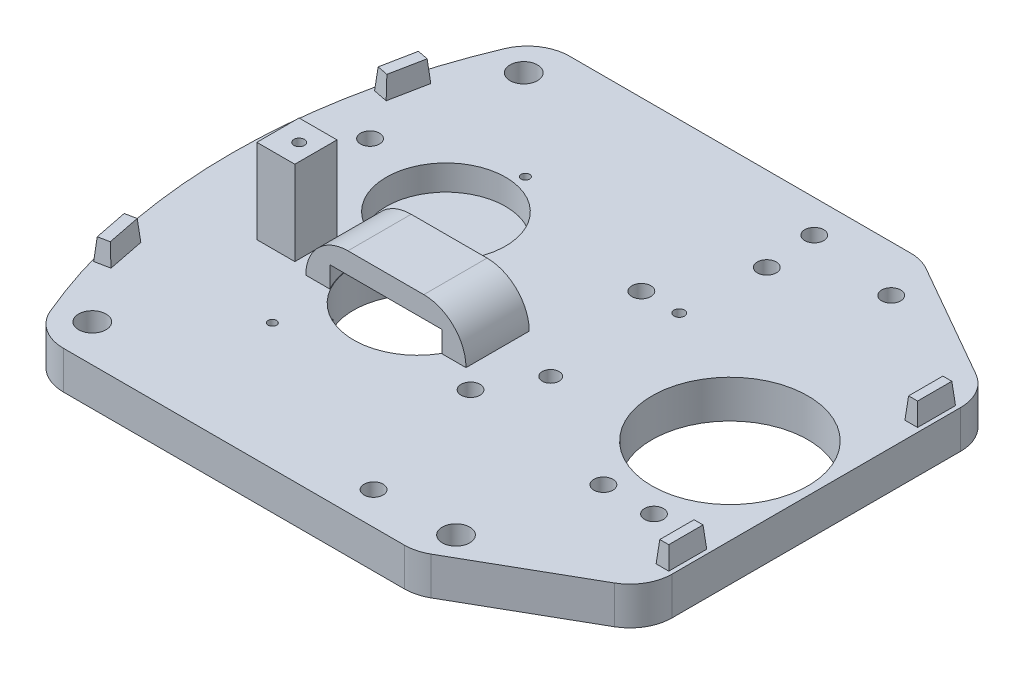
from build123d import *

# Parameters (mm, degrees)
SKETCH1_W                         = 125
SKETCH1_H                         = 120
TOP_BASE_DEPTH                    = 9
SKETCH5_R                         = 14.15
DRIVE_GEAR_HOLE_DEPTH             = 6
SKETCH28_R                        = 15.15
TWO_STAGE_GEAR_HOLE_DEPTH         = 174.51080658
SKETCH8_R                         = 18.5
XL320_FINGER_KNUCKLE_MOUNT_DEPTH  = 174.51080658
SKETCH26_R                        = 1
STRING_HOLES_DEPTH                = 174.51080658
XL320_MOUNT_HOLES_R               = 2.25
XL320_MOUNT_HOLES_M4_DEPTH        = 174.51080658
AX12_MOUNT_HOLES_R                = 2.25
AX12_MOUNT_HOLES_M4_DEPTH         = 174.51080658
NUTS_M4_DEPTH                     = 5
SKETCH34_R                        = 15
HOLES_FOR_M4_IN_FINGER_GEAR_DEPTH = 2
SKETCH31_W                        = 38
SKETCH31_H                        = 15
BOSS_EXTRUDE1_DEPTH               = 10
SKETCH32_R                        = 15.25
CUT_EXTRUDE5_DEPTH                = 5
SKETCH33_R                        = 1
CUT_EXTRUDE6_DEPTH                = 2.5
FILLET2_R                         = 10
CUT_EXTRUDE8_DEPTH                = 174.565549577
FILLET4_R                         = 10
SKETCH37_R                        = 3.25
CONNECT_HOLES_M6_DEPTH            = 10
SKETCH41_R                        = 2
CONNECT_TO_HOUSE_M4_DEPTH         = 174.565549577
SKETCH42_W                        = 3
SKETCH42_H                        = 9
HOUSING_FITS_DEPTH                = 5
HOUSING_FITS_DRAFT                = 5
HOUSING_FITS_PROFILE_2_DEPTH      = 5
HOUSING_FITS_PROFILE_2_DRAFT      = 5
HOUSING_FITS_PROFILE_3_DEPTH      = 5
HOUSING_FITS_PROFILE_3_DRAFT      = 5
HOUSING_FITS_PROFILE_4_DEPTH      = 5
HOUSING_FITS_PROFILE_4_DRAFT      = 5
SKETCH43_R                        = 1
M2_SHAFT_HOLE_DEPTH               = 2
SKETCH54_R                        = 1.5
HOLLOW_SHAFT_HOLE_DEPTH           = 5
SKETCH46_R                        = 1.25
CUT_EXTRUDE11_DEPTH               = 174.565549577
SKETCH47_R                        = 2.25
CUT_EXTRUDE12_DEPTH               = 5
SKETCH48_R                        = 2.875
CUT_EXTRUDE13_DEPTH               = 0.75
SKETCH49_R                        = 1.25
BOSS_EXTRUDE2_DEPTH               = 20
SKETCH51_R                        = 1.25
CUT_EXTRUDE14_DEPTH               = 175.427635425
SKETCH52_R                        = 2.25
CUT_EXTRUDE15_DEPTH               = 5
SKETCH53_R                        = 2.875
CUT_EXTRUDE16_DEPTH               = 0.75


with BuildPart() as part:
    # Sketch1 → Top_Base (new body)
    with BuildSketch(Plane(origin=(0, 0, 0), x_dir=(1, 0, 0), z_dir=(0, 1, 0))):
        with BuildLine():
            ThreePointArc((0, 120), (-13.654246239, 60), (0, 0))
            Line((0, 0), (0, 120))
        make_face()
        with Locations((62.5, 60)):
            Rectangle(SKETCH1_W, SKETCH1_H)
    extrude(amount=TOP_BASE_DEPTH)

    # Sketch5 → Drive_Gear_Hole (cut)
    with BuildSketch(Plane(origin=(0, 9, 0), x_dir=(1, 0, 0), z_dir=(0, 1, 0))):
        with Locations(Location((23.75, 73.41386581, 0), (0, 0, 270))):
            Circle(SKETCH5_R)
    extrude(amount=-DRIVE_GEAR_HOLE_DEPTH, mode=Mode.SUBTRACT)

    # Sketch28 → Two_Stage_Gear_Hole (cut, through all)
    with BuildSketch(Plane(origin=(0, 9, 0), x_dir=(1, 0, 0), z_dir=(0, 1, 0))):
        with Locations(Location((39.169567191, 51.25, 0), (0, 0, 270))):
            Circle(SKETCH28_R)
    extrude(amount=-TWO_STAGE_GEAR_HOLE_DEPTH, mode=Mode.SUBTRACT)

    # Sketch8 → XL320_Finger_Knuckle_Mount (cut, through all)
    with BuildSketch(Plane(origin=(0, 9, 0), x_dir=(1, 0, 0), z_dir=(0, 1, 0))):
        with Locations(Location((104.5, 60, 0), (0, 0, 270))):
            Circle(SKETCH8_R)
    extrude(amount=-XL320_FINGER_KNUCKLE_MOUNT_DEPTH, mode=Mode.SUBTRACT)

    # Sketch26 → String_Holes (cut, through all)
    with BuildSketch(Plane.XZ.offset(-9)):
        with Locations(Location((26, -30, 0), (0, 0, 270))):
            Circle(SKETCH26_R)
        with Locations(Location((26, -90, 0), (0, 0, 90))):
            Circle(SKETCH26_R)
    extrude(amount=STRING_HOLES_DEPTH, mode=Mode.SUBTRACT)

    # XL320_Mount_Holes → XL320_Mount_Holes_(M4) (cut, through all)
    with BuildSketch(Plane(origin=(0, 9, 0), x_dir=(1, 0, 0), z_dir=(0, 1, 0))):
        with Locations(Location((110.5, 36, 0), (0, 0, 270))):
            Circle(XL320_MOUNT_HOLES_R)
        with Locations(Location((98.5, 36, 0), (0, 0, 270))):
            Circle(XL320_MOUNT_HOLES_R)
        with Locations(Location((-0.25, 79.41386581, 0), (0, 0, 270))):
            Circle(XL320_MOUNT_HOLES_R)
        with Locations(Location((-0.25, 67.41386581, 0), (0, 0, 270))):
            Circle(XL320_MOUNT_HOLES_R)
    extrude(amount=-XL320_MOUNT_HOLES_M4_DEPTH, mode=Mode.SUBTRACT)

    # AX12_Mount_Holes → AX12_Mount_Holes_(M4) (cut, through all)
    with BuildSketch(Plane(origin=(0, 9, 0), x_dir=(1, 0, 0), z_dir=(0, 1, 0))):
        with Locations(Location((72.25, 112.25, 0), (0, 0, 270))):
            Circle(AX12_MOUNT_HOLES_R)
        with Locations(Location((63.25, 80.25, 0), (0, 0, 270))):
            Circle(AX12_MOUNT_HOLES_R)
        with Locations(Location((73.25, 100, 0), (0, 0, 270))):
            Circle(AX12_MOUNT_HOLES_R)
        with Locations(Location((93.75, 109, 0), (0, 0, 270))):
            Circle(AX12_MOUNT_HOLES_R)
        with Locations(Location((63.25, 39.75, 0), (0, 0, 270))):
            Circle(AX12_MOUNT_HOLES_R)
        with Locations(Location((72.25, 7.75, 0), (0, 0, 270))):
            Circle(AX12_MOUNT_HOLES_R)
    extrude(amount=-AX12_MOUNT_HOLES_M4_DEPTH, mode=Mode.SUBTRACT)

    # Sketch27 → Nuts_(M4) (cut)
    with BuildSketch(Plane.XZ):
        Polygon((110.5, -31.958548116), (107, -33.979274058), (107, -38.020725942), (110.5, -40.041451884), (114, -38.020725942), (114, -33.979274058), align=None)
        Polygon((98.5, -31.958548116), (95, -33.979274058), (95, -38.020725942), (98.5, -40.041451884), (102, -38.020725942), (102, -33.979274058), align=None)
        Polygon((3.25, -65.393139868), (-0.25, -63.372413926), (-3.75, -65.393139868), (-3.75, -69.434591752), (-0.25, -71.455317694), (3.25, -69.434591752), align=None)
        Polygon((-3.75, -77.393139868), (-3.75, -81.434591752), (-0.25, -83.455317694), (3.25, -81.434591752), (3.25, -77.393139868), (-0.25, -75.372413926), align=None)
    extrude(amount=-NUTS_M4_DEPTH, mode=Mode.SUBTRACT)

    # Sketch34 → Holes_For_M4_In_Finger_Gear (cut)
    with BuildSketch(Plane.XZ):
        with Locations((26, -30)):
            Circle(SKETCH34_R)
        with Locations(Location((26, -90, 0), (0, 0, 270))):
            Circle(SKETCH34_R)
    extrude(amount=-HOLES_FOR_M4_IN_FINGER_GEAR_DEPTH, mode=Mode.SUBTRACT)

    # Sketch31 → Boss-Extrude1 (add)
    with BuildSketch(Plane(origin=(0, 9, 0), x_dir=(1, 0, 0), z_dir=(0, 1, 0))):
        with Locations((39.169567191, 51.25)):
            Rectangle(SKETCH31_W, SKETCH31_H)
    extrude(amount=BOSS_EXTRUDE1_DEPTH)

    # Sketch32 → Cut-Extrude5 (cut)
    with BuildSketch(Plane.XZ.offset(-9)):
        with Locations((39.169567191, -51.25)):
            Circle(SKETCH32_R)
    extrude(amount=-CUT_EXTRUDE5_DEPTH, mode=Mode.SUBTRACT)

    # Sketch33 → Cut-Extrude6 (cut)
    with BuildSketch(Plane.XZ.offset(-14)):
        with Locations(Location((39.169567191, -51.25, 0), (0, 0, 270))):
            Circle(SKETCH33_R)
    extrude(amount=-CUT_EXTRUDE6_DEPTH, mode=Mode.SUBTRACT)

    # Fillet2
    fillet2_edges = [part.edges().sort_by_distance(p)[0] for p in [
        (58.169567191, 19, -51.25),
        (20.169567191, 19, -51.25),
    ]]
    fillet(fillet2_edges, radius=FILLET2_R - 0.0001)  # a hair under: the kernel refuses the full size

    # Sketch36 → Cut-Extrude8 (cut, through all)
    with BuildSketch(Plane(origin=(0, 9, 0), x_dir=(1, 0, 0), z_dir=(0, 1, 0))):
        Polygon((90, 120), (125, 100), (125, 120), align=None)
        Polygon((125, 0), (90, 0), (125, 20), align=None)
    extrude(amount=-CUT_EXTRUDE8_DEPTH, mode=Mode.SUBTRACT)

    # Fillet4
    fillet4_edges = [part.edges().sort_by_distance(p)[0] for p in [
        (90, 4.5, -120),
        (125, 4.5, -100),
        (125, 4.5, -20),
        (90, 4.5, 0),
        (0, 4.5, -120),
        (0, 4.5, 0),
    ]]
    fillet(fillet4_edges, radius=FILLET4_R)

    # Sketch37 → Connect_Holes_(M6) (cut)
    with BuildSketch(Plane(origin=(0, 9, 0), x_dir=(1, 0, 0), z_dir=(0, 1, 0))):
        with Locations(Location((4.459226107, 111.152938298, 0), (0, 0, 270))):
            Circle(SKETCH37_R)
        with Locations(Location((4.459226107, 8.847061702, 0), (0, 0, 270))):
            Circle(SKETCH37_R)
        with Locations(Location((91.344355629, 8.205555711, 0), (0, 0, 270))):
            Circle(SKETCH37_R)
    extrude(amount=-CONNECT_HOLES_M6_DEPTH, mode=Mode.SUBTRACT)

    # Sketch41 → Connect_To_House_(M4) (cut, through all)
    with BuildSketch(Plane(origin=(0, 9, 0), x_dir=(1, 0, 0), z_dir=(0, 1, 0))):
        with Locations(Location((70, 52, 0), (0, 0, 270))):
            Circle(SKETCH41_R)
    extrude(amount=-CONNECT_TO_HOUSE_M4_DEPTH, mode=Mode.SUBTRACT)


with BuildPart() as housing_fits_tool:
    # Sketch42 → Housing_Fits (with draft: the straight prism first)
    with BuildSketch(Plane(origin=(0, 9, 0), x_dir=(1, 0, 0), z_dir=(0, 1, 0))):
        with Locations((122.5, 30.5)):
            Rectangle(SKETCH42_W, SKETCH42_H)
    extrude(amount=HOUSING_FITS_DEPTH)
    # Housing_Fits: the draft: its side faces are tilted about the plane it starts from
    housing_fits_sides = [housing_fits_tool.faces().sort_by_distance(p)[0] for p in [
        (124, 11.5, -30.5),
        (122.5, 11.5, -35),
        (121, 11.5, -30.5),
        (122.5, 11.5, -26),
    ]]
    draft(housing_fits_sides, Plane(origin=(0, 9, 0), x_dir=(1, 0, 0), z_dir=(0, 1, 0)), HOUSING_FITS_DRAFT)


with BuildPart() as part_1:
    add(part.part)

    # Housing_Fits: add housing_fits_tool
    add(housing_fits_tool.part)


with BuildPart() as housing_fits_profile_2_tool:
    # Sketch42 → Housing_Fits profile 2 (with draft: the straight prism first)
    with BuildSketch(Plane(origin=(0, 9, 0), x_dir=(1, 0, 0), z_dir=(0, 1, 0))):
        Polygon((-9.533377338, 30.232888291), (-7.782151246, 21.404909633), (-4.349048435, 22.085942002), (-6.100274527, 30.91392066), align=None)
    extrude(amount=HOUSING_FITS_PROFILE_2_DEPTH)
    # Housing_Fits profile 2: the draft: its side faces are tilted about the plane it starts from
    housing_fits_profile_2_sides = [housing_fits_profile_2_tool.faces().sort_by_distance(p)[0] for p in [
        (-8.657764292, 11.5, -25.818898962),
        (-6.065599841, 11.5, -21.745425818),
        (-5.224661481, 11.5, -26.499931331),
        (-7.816825933, 11.5, -30.573404475),
    ]]
    draft(housing_fits_profile_2_sides, Plane(origin=(0, 9, 0), x_dir=(1, 0, 0), z_dir=(0, 1, 0)), HOUSING_FITS_PROFILE_2_DRAFT)


with BuildPart() as part_2:
    add(part_1.part)

    # Housing_Fits profile 2: add housing_fits_profile_2_tool
    add(housing_fits_profile_2_tool.part)


with BuildPart() as housing_fits_profile_3_tool:
    # Sketch42 → Housing_Fits profile 3 (with draft: the straight prism first)
    with BuildSketch(Plane(origin=(0, 9, 0), x_dir=(1, 0, 0), z_dir=(0, 1, 0))):
        Polygon((-4.349048435, 97.914057998), (-7.782151246, 98.595090367), (-9.533377338, 89.767111709), (-6.100274527, 89.08607934), align=None)
    extrude(amount=HOUSING_FITS_PROFILE_3_DEPTH)
    # Housing_Fits profile 3: the draft: its side faces are tilted about the plane it starts from
    housing_fits_profile_3_sides = [housing_fits_profile_3_tool.faces().sort_by_distance(p)[0] for p in [
        (-6.065599841, 11.5, -98.254574182),
        (-8.657764292, 11.5, -94.181101038),
        (-7.816825933, 11.5, -89.426595525),
        (-5.224661481, 11.5, -93.500068669),
    ]]
    draft(housing_fits_profile_3_sides, Plane(origin=(0, 9, 0), x_dir=(1, 0, 0), z_dir=(0, 1, 0)), HOUSING_FITS_PROFILE_3_DRAFT)


with BuildPart() as part_3:
    add(part_2.part)

    # Housing_Fits profile 3: add housing_fits_profile_3_tool
    add(housing_fits_profile_3_tool.part)


with BuildPart() as housing_fits_profile_4_tool:
    # Sketch42 → Housing_Fits profile 4 (with draft: the straight prism first)
    with BuildSketch(Plane(origin=(0, 9, 0), x_dir=(1, 0, 0), z_dir=(0, 1, 0))):
        with Locations((122.5, 89.5)):
            Rectangle(SKETCH42_W, SKETCH42_H)
    extrude(amount=HOUSING_FITS_PROFILE_4_DEPTH)
    # Housing_Fits profile 4: the draft: its side faces are tilted about the plane it starts from
    housing_fits_profile_4_sides = [housing_fits_profile_4_tool.faces().sort_by_distance(p)[0] for p in [
        (122.5, 11.5, -94),
        (121, 11.5, -89.5),
        (122.5, 11.5, -85),
        (124, 11.5, -89.5),
    ]]
    draft(housing_fits_profile_4_sides, Plane(origin=(0, 9, 0), x_dir=(1, 0, 0), z_dir=(0, 1, 0)), HOUSING_FITS_PROFILE_4_DRAFT)


with BuildPart() as part_4:
    add(part_3.part)

    # Housing_Fits profile 4: add housing_fits_profile_4_tool
    add(housing_fits_profile_4_tool.part)

    # Sketch43 → M2_Shaft_Hole (cut)
    with BuildSketch(Plane.XZ):
        with Locations(Location((39.169567191, -68.75, 0), (0, 0, 270))):
            Circle(SKETCH43_R)
    extrude(amount=-M2_SHAFT_HOLE_DEPTH, mode=Mode.SUBTRACT)

    # Sketch54 → Hollow_Shaft_Hole (cut)
    with BuildSketch(Plane.XZ.offset(-2)):
        with Locations(Location((26, -30, 0), (0, 0, 270))):
            Circle(SKETCH54_R)
        with Locations(Location((26, -90, 0), (0, 0, 270))):
            Circle(SKETCH54_R)
    extrude(amount=-HOLLOW_SHAFT_HOLE_DEPTH, mode=Mode.SUBTRACT)

    # Sketch46 → Cut-Extrude11 (cut, through all)
    with BuildSketch(Plane(origin=(0, 9, 0), x_dir=(1, 0, 0), z_dir=(0, 1, 0))):
        with Locations(Location((72.25, 80.25, 0), (0, 0, 270))):
            Circle(SKETCH46_R)
    extrude(amount=-CUT_EXTRUDE11_DEPTH, mode=Mode.SUBTRACT)

    # Sketch47 → Cut-Extrude12 (cut)
    with BuildSketch(Plane.XZ):
        with Locations(Location((72.25, -80.25, 0), (0, 0, 270))):
            Circle(SKETCH47_R)
    extrude(amount=-CUT_EXTRUDE12_DEPTH, mode=Mode.SUBTRACT)

    # Sketch48 → Cut-Extrude13 (cut)
    with BuildSketch(Plane.XZ):
        with Locations(Location((72.25, -80.25, 0), (0, 0, 270))):
            Circle(SKETCH48_R)
    extrude(amount=-CUT_EXTRUDE13_DEPTH, mode=Mode.SUBTRACT)

    # Sketch49 → Boss-Extrude2 (add)
    with BuildSketch(Plane(origin=(0, 9, 0), x_dir=(1, 0, 0), z_dir=(0, 1, 0))):
        Polygon((16.093653761, 45.2322), (12.132053761, 45.2322), (7.093653761, 45.2322), (7.093653761, 55.2322), (12.132053761, 55.2322), (16.093653761, 55.2322), align=None)
        with Locations(Location((12.132053761, 50.2322, 0), (0, 0, 270))):
            Circle(SKETCH49_R, mode=Mode.SUBTRACT)
    extrude(amount=BOSS_EXTRUDE2_DEPTH)

    # Sketch51 → Cut-Extrude14 (cut, through all)
    with BuildSketch(Plane(origin=(0, 9, 0), x_dir=(1, 0, 0), z_dir=(0, 1, 0))):
        with Locations(Location((12.132053761, 50.2322, 0), (0, 0, 270))):
            Circle(SKETCH51_R)
    extrude(amount=-CUT_EXTRUDE14_DEPTH, mode=Mode.SUBTRACT)

    # Sketch52 → Cut-Extrude15 (cut)
    with BuildSketch(Plane.XZ):
        with Locations(Location((12.132053761, -50.2322, 0), (0, 0, 270))):
            Circle(SKETCH52_R)
    extrude(amount=-CUT_EXTRUDE15_DEPTH, mode=Mode.SUBTRACT)

    # Sketch53 → Cut-Extrude16 (cut)
    with BuildSketch(Plane.XZ):
        with Locations(Location((12.132053761, -50.2322, 0), (0, 0, 270))):
            Circle(SKETCH53_R)
    extrude(amount=-CUT_EXTRUDE16_DEPTH, mode=Mode.SUBTRACT)


solid = part_4.part
